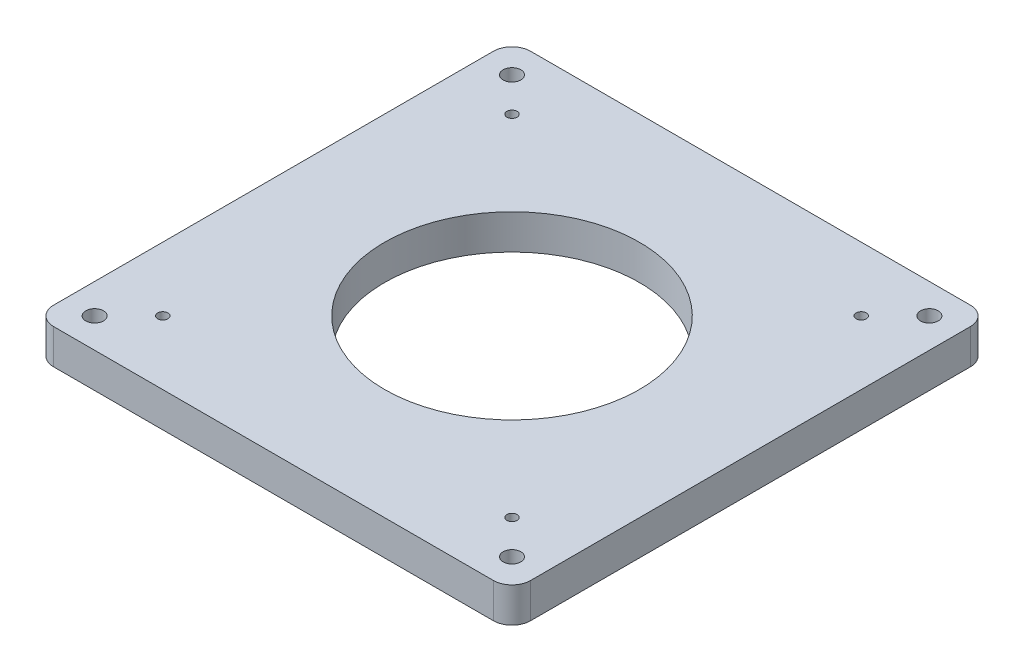
from build123d import *

# Parameters (mm, degrees)
BOSS_EXTRUDE1_DEPTH = 7.5


with BuildPart() as part:
    # Sketch1 → Boss-Extrude1 (new body)
    with BuildSketch(Plane(origin=(0, 0, 0), x_dir=(1, 0, 0), z_dir=(0, 1, 0))):
        with BuildLine():
            ThreePointArc((-42.003937008, 34.906496063), (-44.832364133, 33.734923188), (-46.003937008, 30.906496063))
            Line((-46.003937008, 30.906496063), (-46.003937008, -63.593503937))
            ThreePointArc((-46.003937008, -63.593503937), (-44.832364133, -66.421931062), (-42.003937008, -67.593503937))
            Line((-42.003937008, -67.593503937), (52.496062992, -67.593503937))
            ThreePointArc((52.496062992, -67.593503937), (55.324490117, -66.421931062), (56.496062992, -63.593503937))
            Line((56.496062992, -63.593503937), (56.496062992, 30.906496063))
            ThreePointArc((56.496062992, 30.906496063), (55.324490117, 33.734923188), (52.496062992, 34.906496063))
            Line((52.496062992, 34.906496063), (-42.003937008, 34.906496063))
        make_face()
        with BuildLine():
            ThreePointArc((-40.947455256, -62.537022185), (-40.947455256, -59.850016416), (-38.260449487, -59.850016416))
            ThreePointArc((-38.260449487, -59.850016416), (-37.84858126, -60.466420779), (-37.703952372, -61.193519301))
            ThreePointArc((-37.703952372, -61.193519301), (-38.87685385, -62.948890412), (-40.947455256, -62.537022185))
        make_face(mode=Mode.SUBTRACT)
        with BuildLine():
            ThreePointArc((-33.056143578, -54.645710507), (-33.056143578, -53.090075588), (-31.500508659, -53.090075588))
            ThreePointArc((-31.500508659, -53.090075588), (-31.262058633, -53.446941272), (-31.178326118, -53.867893048))
            ThreePointArc((-31.178326118, -53.867893048), (-31.857374343, -54.884160533), (-33.056143578, -54.645710507))
        make_face(mode=Mode.SUBTRACT)
        with BuildLine():
            ThreePointArc((51.996078356, -61.193519301), (51.851449468, -61.920617822), (51.43958124, -62.537022185))
            ThreePointArc((51.43958124, -62.537022185), (48.752575472, -62.537022185), (48.752575472, -59.850016416))
            ThreePointArc((48.752575472, -59.850016416), (50.823176877, -59.438148189), (51.996078356, -61.193519301))
        make_face(mode=Mode.SUBTRACT)
        with BuildLine():
            ThreePointArc((43.870452103, -53.867893048), (43.786719589, -54.288844823), (43.548269562, -54.645710507))
            ThreePointArc((43.548269562, -54.645710507), (41.992634643, -54.645710507), (41.992634643, -53.090075588))
            ThreePointArc((41.992634643, -53.090075588), (43.191403878, -52.851625562), (43.870452103, -53.867893048))
        make_face(mode=Mode.SUBTRACT)
        with BuildLine():
            ThreePointArc((32.646062992, -16.343503937), (30.560362183, -26.829029984), (24.620788797, -35.718229742))
            ThreePointArc((24.620788797, -35.718229742), (5.246062992, -43.743503937), (-14.128662812, -35.718229742))
            ThreePointArc((-14.128662812, -35.718229742), (-22.153937008, -16.343503937), (-14.128662812, 3.031221868))
            ThreePointArc((-14.128662812, 3.031221868), (5.246062992, 11.056496063), (24.620788797, 3.031221868))
            ThreePointArc((24.620788797, 3.031221868), (30.560362183, -5.85797789), (32.646062992, -16.343503937))
        make_face(mode=Mode.SUBTRACT)
        with BuildLine():
            ThreePointArc((-31.178326118, 21.180885174), (-31.262058633, 20.759933398), (-31.500508659, 20.403067714))
            ThreePointArc((-31.500508659, 20.403067714), (-33.056143578, 20.403067714), (-33.056143578, 21.958702633))
            ThreePointArc((-33.056143578, 21.958702633), (-31.857374343, 22.197152659), (-31.178326118, 21.180885174))
        make_face(mode=Mode.SUBTRACT)
        with BuildLine():
            ThreePointArc((-37.703952372, 28.506511427), (-37.84858126, 27.779412905), (-38.260449487, 27.163008542))
            ThreePointArc((-38.260449487, 27.163008542), (-40.947455256, 27.163008542), (-40.947455256, 29.850014311))
            ThreePointArc((-40.947455256, 29.850014311), (-38.87685385, 30.261882538), (-37.703952372, 28.506511427))
        make_face(mode=Mode.SUBTRACT)
        with BuildLine():
            ThreePointArc((43.870452103, 21.180885174), (43.191403878, 20.164617688), (41.992634643, 20.403067714))
            ThreePointArc((41.992634643, 20.403067714), (41.992634643, 21.958702633), (43.548269562, 21.958702633))
            ThreePointArc((43.548269562, 21.958702633), (43.786719589, 21.601836949), (43.870452103, 21.180885174))
        make_face(mode=Mode.SUBTRACT)
        with BuildLine():
            ThreePointArc((51.996078356, 28.506511427), (50.823176877, 26.751140315), (48.752575472, 27.163008542))
            ThreePointArc((48.752575472, 27.163008542), (48.752575472, 29.850014311), (51.43958124, 29.850014311))
            ThreePointArc((51.43958124, 29.850014311), (51.851449468, 29.233609948), (51.996078356, 28.506511427))
        make_face(mode=Mode.SUBTRACT)
    extrude(amount=BOSS_EXTRUDE1_DEPTH)


solid = part.part
